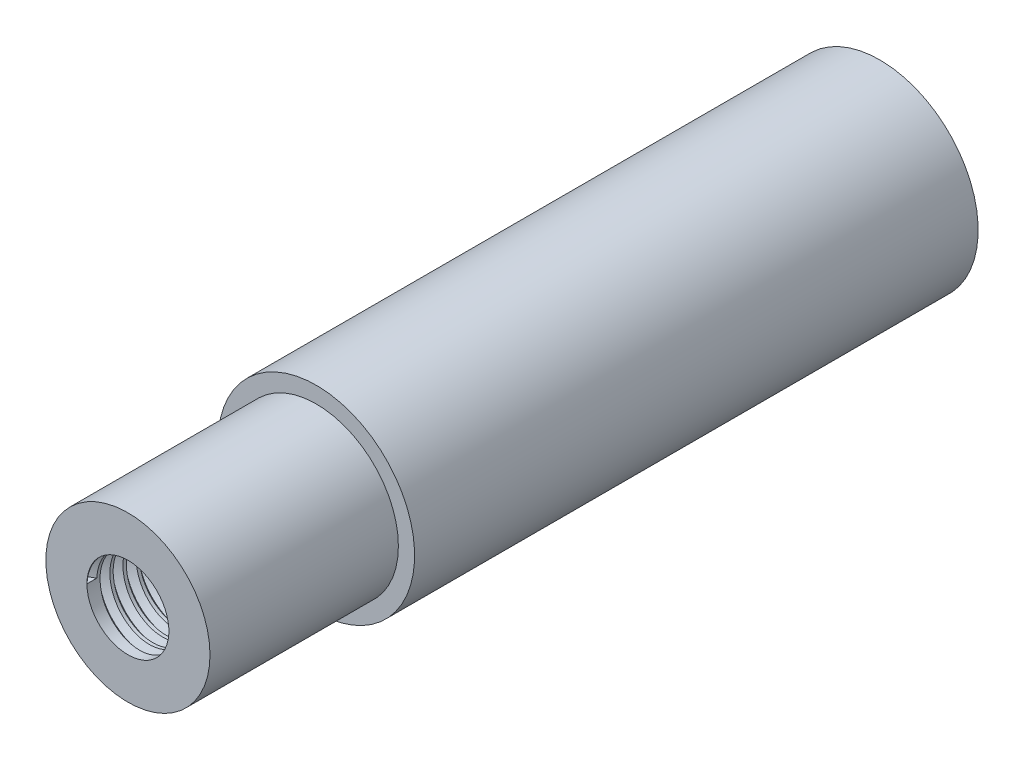
from build123d import *
from build123d.topology import SkipClean

# Parameters (mm, degrees)
SKETCH1_R           = 6
SKETCH1_R_2         = 5.01
BOSS_EXTRUDE1_DEPTH = 34.4
SKETCH2_R           = 5.01
BOSS_EXTRUDE2_DEPTH = 11.5
SKETCH3_R           = 2.5
CUT_EXTRUDE1_DEPTH  = 11.5
THREAD1_PITCH       = 0.8
BOSS_EXTRUDE4_START = 27
SKETCH8_R           = 5.01
SKETCH8_R_2         = 2.9330127
BOSS_EXTRUDE4_DEPTH = 27


with BuildPart() as part:
    # Sketch1 → Boss-Extrude1 (new body)
    with BuildSketch(Plane.XY):
        with Locations(Location((0, 0, 0), (0, 0, 180))):
            Circle(SKETCH1_R)
        with Locations(Location((0, 0, 0), (0, 0, 180))):
            Circle(SKETCH1_R_2, mode=Mode.SUBTRACT)
    extrude(amount=BOSS_EXTRUDE1_DEPTH)



with BuildPart() as body_2:
    # Sketch2 → Boss-Extrude2 (new body)
    with BuildSketch(Plane.XY.offset(34.4)):
        with Locations(Location((0, 0, 0), (0, 0, 180))):
            Circle(SKETCH2_R)
    extrude(amount=BOSS_EXTRUDE2_DEPTH)

    # Sketch3 → Cut-Extrude1 (cut)
    with BuildSketch(Plane.XY.offset(45.9)):
        Circle(SKETCH3_R)
    extrude(amount=-CUT_EXTRUDE1_DEPTH, mode=Mode.SUBTRACT)

    # Thread1: the profile of Thread Profile1 profile screwed along a right-hand helix of 14.375 turns, 8 arcs to a turn; built about Z, then put on its axis
    thread1_z = Axis((0, 0, 0), (0, 0, 1))
    thread1_corners = [(2.4997, 0, -0.000173205), (2.9330127, 0, 0.249999999), (2.9330127, 0, 0.349999999), (2.4997, 0, 0.600173203)]
    with BuildLine(mode=Mode.PRIVATE) as thread1_profile:
        Line(thread1_corners[0], thread1_corners[1])
        Line(thread1_corners[1], thread1_corners[2])
        Line(thread1_corners[2], thread1_corners[3])
        Line(thread1_corners[3], thread1_corners[0])
    thread1_cap = Face(thread1_profile.wire())
    thread1_turn_angles = [0, 22.5, 45, 67.5, 90, 112.5, 135, 157.5, 180, 202.5, 225, 247.5, 270, 292.5, 315, 337.5, 360]
    thread1_turn_weights = [1, 0.9238795325112867, 1, 0.9238795325112867, 1, 0.9238795325112867, 1, 0.9238795325112867, 1, 0.9238795325112867, 1, 0.9238795325112867, 1, 0.9238795325112867, 1, 0.9238795325112867, 1]
    thread1_turn_rails = [Edge.make_bspline([Vector(p[0], p[1], 0).rotate(thread1_z, thread1_turn_angles[k]) / thread1_turn_weights[k] + Vector(0, 0, p[2] + THREAD1_PITCH * thread1_turn_angles[k] / 360) for k in range(17)], [0, 0, 0, 1, 1, 2, 2, 3, 3, 4, 4, 5, 5, 6, 6, 7, 7, 8, 8, 8], 2, thread1_turn_weights) for p in thread1_corners]
    thread1_turn_sides = [Face.make_surface_from_curves(thread1_turn_rails[p[0]], thread1_turn_rails[p[1]]) for p in [(0, 1), (1, 2), (2, 3), (3, 0)]]
    thread1_last_angles = [5040, 5062.5, 5085, 5107.5, 5130, 5152.5, 5175]
    thread1_last_weights = [1, 0.9238795325112867, 1, 0.9238795325112867, 1, 0.9238795325112928, 1]
    thread1_last_rails = [Edge.make_bspline([Vector(p[0], p[1], 0).rotate(thread1_z, thread1_last_angles[k]) / thread1_last_weights[k] + Vector(0, 0, p[2] + THREAD1_PITCH * thread1_last_angles[k] / 360) for k in range(7)], [0, 0, 0, 1, 1, 2, 2, 3, 3, 3], 2, thread1_last_weights) for p in thread1_corners]
    thread1_last_sides = [Face.make_surface_from_curves(thread1_last_rails[p[0]], thread1_last_rails[p[1]]) for p in [(0, 1), (1, 2), (2, 3), (3, 0)]]
    thread1 = Plane(origin=(0, 0, 45.9), x_dir=(-1, 0, 0), z_dir=(0, 0, -1)) * Solid(Shell([*[p.moved(Location((0, 0, THREAD1_PITCH * i))) for i in range(14) for p in thread1_turn_sides], *thread1_last_sides, thread1_cap, thread1_cap.rotate(thread1_z, 5175).moved(Location((0, 0, THREAD1_PITCH * 5175 / 360)))]))
    add(thread1, mode=Mode.SUBTRACT)


with BuildPart() as part_1:
    with SkipClean():  # the faces are left unmerged after this step: merging them gives an invalid solid
        add(part.part)

        add(body_2.part)  # Boss-Extrude4 merges body 2
        # Sketch8 → Boss-Extrude4 (add)
        with BuildSketch(Plane(origin=(0, 0, 34.4), x_dir=(-1, 0, 0), z_dir=(0, 0, -1)).offset(BOSS_EXTRUDE4_START)):
            Circle(SKETCH8_R)
            with Locations(Location((0, 0, 0), (0, 0, 22.500000479))):
                Circle(SKETCH8_R_2, mode=Mode.SUBTRACT)
        extrude(amount=-BOSS_EXTRUDE4_DEPTH)


solid = part_1.part
